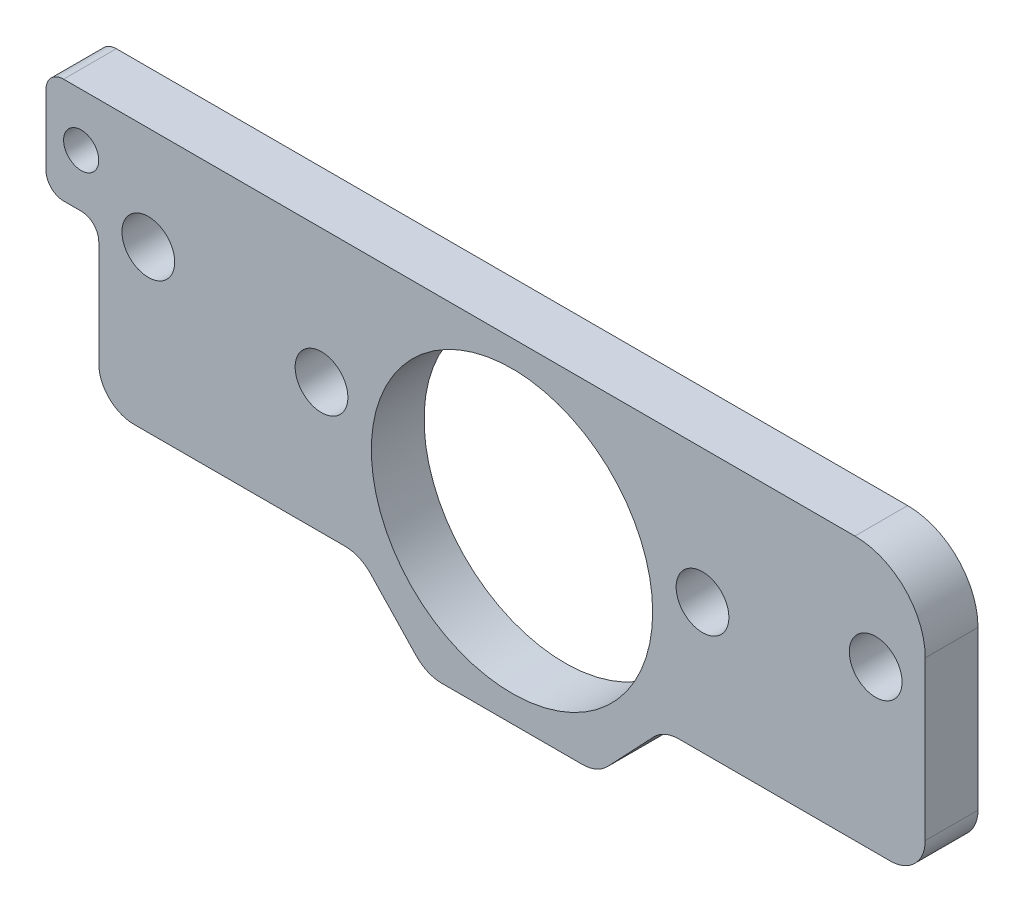
from build123d import *

# Parameters (mm, degrees)
SKETCH_1_R      = 8
SKETCH_1_R_2    = 1.5
SKETCH_1_R_3    = 1
EXTRUDE_1_DEPTH = 3


with BuildPart() as part:
    # Эскиз1 → Бобышка-Вытянуть1 (new body)
    with BuildSketch(Plane.XY):
        with BuildLine():
            Line((-6.518358777, -10.340325606), (1.465690046, -10.340325606))
            ThreePointArc((1.465690046, -10.340325606), (2.256306564, -10.177422642), (2.918129308, -9.715251127))
            Line((2.918129308, -9.715251127), (5.521226372, -6.965400084))
            ThreePointArc((5.521226372, -6.965400084), (6.183049116, -6.503228569), (6.973665634, -6.340325606))
            Line((6.973665634, -6.340325606), (18.973665634, -6.340325606))
            ThreePointArc((18.973665634, -6.340325606), (20.387879197, -5.754539168), (20.973665634, -4.340325606))
            Line((20.973665634, -4.340325606), (20.973665634, 4.659674394))
            ThreePointArc((20.973665634, 4.659674394), (19.802092759, 7.488101519), (16.973665634, 8.659674394))
            Line((16.973665634, 8.659674394), (-22.026334366, 8.659674394))
            Line((-22.026334366, 8.659674394), (-28.026334366, 8.659674394))
            ThreePointArc((-28.026334366, 8.659674394), (-28.733441147, 8.366781175), (-29.026334366, 7.659674394))
            Line((-29.026334366, 7.659674394), (-29.026334366, 3.659674394))
            ThreePointArc((-29.026334366, 3.659674394), (-28.733441147, 2.952567613), (-28.026334366, 2.659674394))
            Line((-28.026334366, 2.659674394), (-27.026334366, 2.659674394))
            ThreePointArc((-27.026334366, 2.659674394), (-26.319227584, 2.366781175), (-26.026334366, 1.659674394))
            Line((-26.026334366, 1.659674394), (-26.026334366, -4.340325606))
            ThreePointArc((-26.026334366, -4.340325606), (-25.440547928, -5.754539168), (-24.026334366, -6.340325606))
            Line((-24.026334366, -6.340325606), (-12.026334366, -6.340325606))
            ThreePointArc((-12.026334366, -6.340325606), (-11.235717848, -6.503228569), (-10.573895103, -6.965400084))
            Line((-10.573895103, -6.965400084), (-7.970798039, -9.715251127))
            ThreePointArc((-7.970798039, -9.715251127), (-7.308975295, -10.177422642), (-6.518358777, -10.340325606))
        make_face()
        with Locations((-2.526334366, -0.840325606)):
            Circle(SKETCH_1_R, mode=Mode.SUBTRACT)
        with Locations((-23.207297179, 2.806286125)):
            Circle(SKETCH_1_R_2, mode=Mode.SUBTRACT)
        with Locations((-13.359219649, 1.069804348)):
            Circle(SKETCH_1_R_2, mode=Mode.SUBTRACT)
        with Locations((8.306550917, 1.069804348)):
            Circle(SKETCH_1_R_2, mode=Mode.SUBTRACT)
        with Locations((18.154628448, 2.806286125)):
            Circle(SKETCH_1_R_2, mode=Mode.SUBTRACT)
        with Locations((-27.026334366, 5.659674394)):
            Circle(SKETCH_1_R_3, mode=Mode.SUBTRACT)
    extrude(amount=EXTRUDE_1_DEPTH)


solid = part.part
